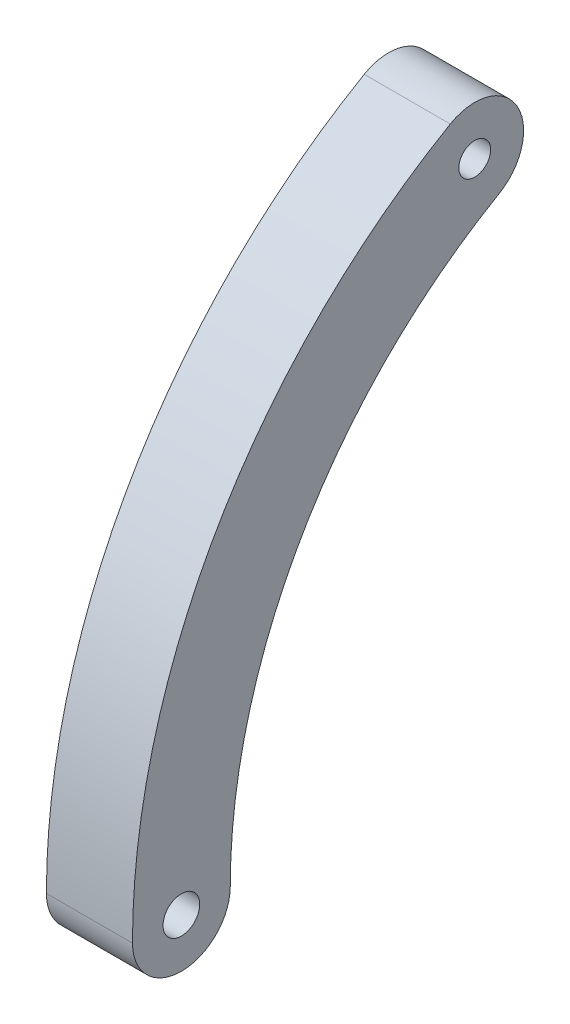
from build123d import *

# Parameters (mm, degrees)
ESQUISSE1_R        = 1.190625
ESQUISSE1_R_2      = 1.031875
BOSS_EXTRU_1_DEPTH = 5.588


with BuildPart() as part:
    # Esquisse1 → Boss.-Extru.1 (new body)
    with BuildSketch(Plane(origin=(0, 0, 0), x_dir=(0, 0, -1), z_dir=(1, 0, 0))):
        with BuildLine():
            ThreePointArc((-34.925, 0), (-30.245937227, 17.4625), (-17.4625, 30.245937227))
            ThreePointArc((-17.4625, 30.245937227), (-16.300369343, 34.583067884), (-20.6375, 35.745198541))
            ThreePointArc((-20.6375, 35.745198541), (-35.745198541, 20.6375), (-41.275, 0))
            ThreePointArc((-41.275, 0), (-38.1, -3.175), (-34.925, 0))
        make_face()
        with Locations((-38.1, 0)):
            Circle(ESQUISSE1_R, mode=Mode.SUBTRACT)
        with Locations((-19.05, 32.995567884)):
            Circle(ESQUISSE1_R_2, mode=Mode.SUBTRACT)
    extrude(amount=BOSS_EXTRU_1_DEPTH)


solid = part.part
